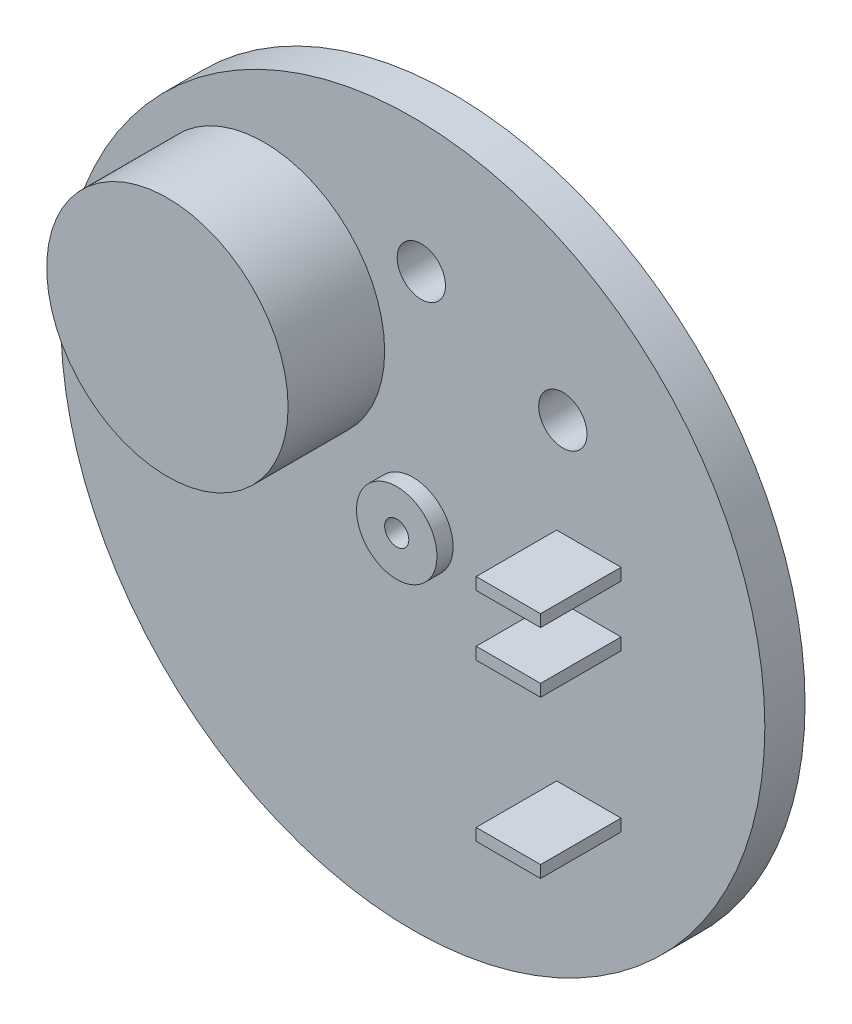
from build123d import *

# Parameters (mm, degrees)
ESQUISSE1_R             = 43.75
ESQUISSE1_R_2           = 1.5
BOSS_EXTRU_1_DEPTH      = 5
ESQUISSE2_R             = 15
BOSS_EXTRU_2_DEPTH      = 12
ESQUISSE3_W             = 8
ESQUISSE3_H             = 1.5
BOSS_EXTRU_3_DEPTH      = 10
ESQUISSE5_R             = 5
ESQUISSE5_R_2           = 1.5
BOSS_EXTRU_5_DEPTH      = 2
ESQUISSE7_R             = 3
ENL_V_MAT_EXTRU_1_DEPTH = 10


with BuildPart() as part:
    # Esquisse1 → Boss.-Extru.1 (new body)
    with BuildSketch(Plane.XY):
        Circle(ESQUISSE1_R)
        Circle(ESQUISSE1_R_2, mode=Mode.SUBTRACT)
    extrude(amount=BOSS_EXTRU_1_DEPTH)

    # Esquisse2 → Boss.-Extru.2 (add)
    with BuildSketch(Plane.XY.offset(5)):
        with Locations((-18.5, 16.815171721)):
            Circle(ESQUISSE2_R)
    extrude(amount=BOSS_EXTRU_2_DEPTH)

    # Esquisse3 → Boss.-Extru.3 (add)
    with BuildSketch(Plane.XY.offset(5)):
        with Locations((21.875, 0)):
            Rectangle(ESQUISSE3_W, ESQUISSE3_H)
        with Locations((21.875, 7.5)):
            Rectangle(ESQUISSE3_W, ESQUISSE3_H)
        with Locations((21.875, -19.5)):
            Rectangle(ESQUISSE3_W, ESQUISSE3_H)
    extrude(amount=BOSS_EXTRU_3_DEPTH)

    # Esquisse5 → Boss.-Extru.5 (add)
    with BuildSketch(Plane.XY.offset(5)):
        Circle(ESQUISSE5_R)
        Circle(ESQUISSE5_R_2, mode=Mode.SUBTRACT)
    extrude(amount=BOSS_EXTRU_5_DEPTH)

    # Esquisse7 → Enlèv. mat.-Extru.1 (cut)
    with BuildSketch(Plane(origin=(0, 0, 0), x_dir=(-1, 0, 0), z_dir=(0, 0, -1))):
        with Locations((-1.056186777, 27.661064142)):
            Circle(ESQUISSE7_R)
        with Locations((-18.640426872, 20.464224538)):
            Circle(ESQUISSE7_R)
    extrude(amount=-ENL_V_MAT_EXTRU_1_DEPTH, mode=Mode.SUBTRACT)


solid = part.part
